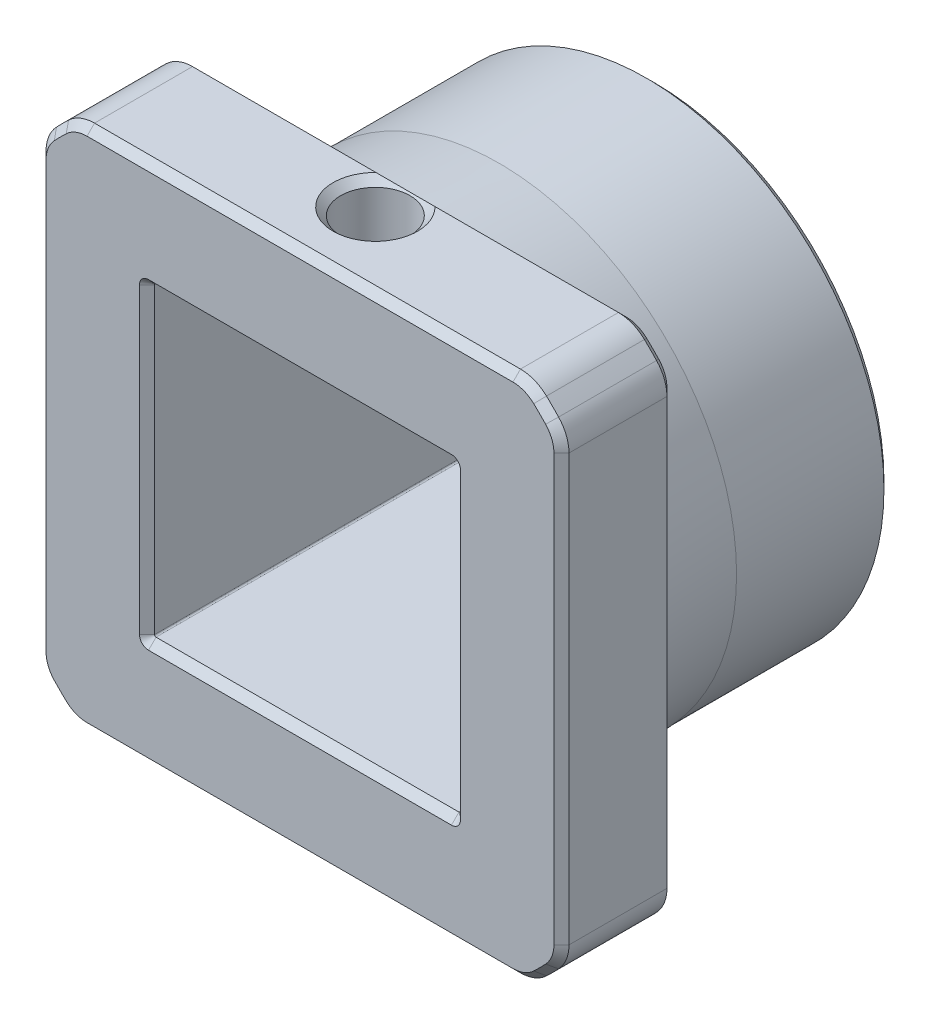
from build123d import *

# Parameters (mm, degrees)
SKIZZE1_R                       = 15.75
SKIZZE1_W                       = 20.3
SKIZZE1_H                       = 20.3
AUFSATZ_LINEAR_AUSTRAGEN1_DEPTH = 16
SKIZZE2_W                       = 20.3
SKIZZE2_H                       = 20.3
AUFSATZ_LINEAR_AUSTRAGEN2_DEPTH = 7.5
SCHNITT_LINEAR_AUSTRAGEN1_REACH = 47.358
SKIZZE3_R                       = 2.3
CHAMFER1_SIZE                   = 0.4
CHAMFER1_SIZE2                  = 5.720266503
VERRUNDUNG1_R                   = 0.1
VERRUNDUNG2_R                   = 2.5
FASE1_SIZE                      = 0.5
FASE4_SIZE                      = 0.5


with BuildPart() as part:
    # Skizze1 → Aufsatz-Linear austragen1 (new body)
    with BuildSketch(Plane.XY):
        Circle(SKIZZE1_R)
        Rectangle(SKIZZE1_W, SKIZZE1_H, mode=Mode.SUBTRACT)
    extrude(amount=AUFSATZ_LINEAR_AUSTRAGEN1_DEPTH)

    # Skizze2 → Aufsatz-Linear austragen2 (add)
    with BuildSketch(Plane.XY.offset(16)):
        with BuildLine():
            Line((-15.098923803, 17.35), (15.098923803, 17.35))
            ThreePointArc((15.098923803, 17.35), (16.263455967, 16.263455967), (17.35, 15.098923803))
            Line((17.35, 15.098923803), (17.35, -15.098923803))
            ThreePointArc((17.35, -15.098923803), (16.263455967, -16.263455967), (15.098923803, -17.35))
            Line((15.098923803, -17.35), (-15.098923803, -17.35))
            ThreePointArc((-15.098923803, -17.35), (-16.263455967, -16.263455967), (-17.35, -15.098923803))
            Line((-17.35, -15.098923803), (-17.35, 15.098923803))
            ThreePointArc((-17.35, 15.098923803), (-16.263455967, 16.263455967), (-15.098923803, 17.35))
        make_face()
        Rectangle(SKIZZE2_W, SKIZZE2_H, mode=Mode.SUBTRACT)
    extrude(amount=AUFSATZ_LINEAR_AUSTRAGEN2_DEPTH)

    # Skizze3 → Schnitt-Linear austragen1 (cut, up to next)
    with BuildSketch(Plane(origin=(0, 17.35, 0), x_dir=(1, 0, 0), z_dir=(0, 1, 0)), mode=Mode.PRIVATE) as schnitt_linear_austragen1_sk1:
        with Locations(Location((0, -18.5, 0), (0, 0, 270))):
            Circle(SKIZZE3_R)
    schnitt_linear_austragen1_tool1 = extrude(schnitt_linear_austragen1_sk1.sketch, amount=-SCHNITT_LINEAR_AUSTRAGEN1_REACH, mode=Mode.PRIVATE) & part.part
    add(schnitt_linear_austragen1_tool1.solids().sort_by_distance((0, 17.35, 18.5))[0], mode=Mode.SUBTRACT)

    # Chamfer1
    chamfer1_edges = [part.edges().sort_by_distance(p)[0] for p in [
        (-15.75, 0, 16),
    ]]
    chamfer1_side = [part.faces().sort_by_distance(p)[0] for p in [
        (-15.916455967, 15.916455967, 16),
    ]]
    chamfer(chamfer1_edges, length=CHAMFER1_SIZE, length2=CHAMFER1_SIZE2, reference=chamfer1_side[0])

    # Verrundung1
    verrundung1_edges = [part.edges().sort_by_distance(p)[0] for p in [
        (10.15, -10.15, 11.75),
        (10.15, 10.15, 11.75),
        (-10.15, 10.15, 11.75),
        (-10.15, -10.15, 11.75),
    ]]
    fillet(verrundung1_edges, radius=VERRUNDUNG1_R)

    # Verrundung2
    verrundung2_edges = [part.edges().sort_by_distance(p)[0] for p in [
        (-15.098923803, 17.35, 19.75),
        (-17.35, 15.098923803, 19.75),
        (-17.35, -15.098923803, 19.75),
        (-15.098923803, -17.35, 19.75),
        (15.098923803, -17.35, 19.75),
        (17.35, -15.098923803, 19.75),
        (17.35, 15.098923803, 19.75),
        (15.098923803, 17.35, 19.75),
    ]]
    fillet(verrundung2_edges, radius=VERRUNDUNG2_R)

    # Fase1
    # the kernel refuses this chamfer: 0.5 mm, written as the material it takes off along each edge
    with BuildSketch(Plane(origin=(-17.35, -14.13249801, 23.5), x_dir=(0.9996219169112968, 0, 0.027495876610589005), z_dir=(0, 1, 0)), Plane(origin=(14.13249801, -17.35, 23.5), x_dir=(0, 0.9996219169112968, 0.027495876610589005), z_dir=(-1, 0, 0)), Plane(origin=(17.35, 14.13249801, 23.5), x_dir=(-0.9996219169112968, 0, 0.027495876610589005), z_dir=(0, -1, 0)), Plane(origin=(-14.13249801, 17.35, 23.5), x_dir=(0, -0.9996219169112968, 0.027495876610589005), z_dir=(1, 0, 0))) as fase1_piece_1:
        Polygon((FASE1_SIZE * 0.999621916911, FASE1_SIZE * 0.0274958766106), (-FASE1_SIZE * 0.0274958766106, FASE1_SIZE * 0.999621916911), (0, 0), align=None)
    extrude(amount=28.26499602, mode=Mode.SUBTRACT)
    with BuildSketch(Plane(origin=(0, 0, 23.5), x_dir=(-0.7243902439024396, 0.6893901468246876, 0), z_dir=(-0.6893901468246876, -0.7243902439024396, 0))) as fase1_piece_2:
        Polygon((23 - FASE1_SIZE, 0), (23, FASE1_SIZE), (23, 0), align=None)
    revolve(axis=Axis((0, 0, 23.5), (0, 0, -1)), revolution_arc=2.836293852, mode=Mode.SUBTRACT)
    with BuildSketch(Plane(origin=(0, 0, 23.5), x_dir=(0.7243902439024391, -0.6893901468246878, 0), z_dir=(0.6893901468246878, 0.7243902439024391, 0))) as fase1_piece_3:
        Polygon((23 - FASE1_SIZE, 0), (23, FASE1_SIZE), (23, 0), align=None)
    revolve(axis=Axis((0, 0, 23.5), (0, 0, -1)), revolution_arc=2.836293852, mode=Mode.SUBTRACT)
    with BuildSketch(Plane(origin=(0, 0, 23.5), x_dir=(0.689390146824687, 0.7243902439024399, 0), z_dir=(-0.7243902439024399, 0.689390146824687, 0))) as fase1_piece_4:
        Polygon((23 - FASE1_SIZE, 0), (23, FASE1_SIZE), (23, 0), align=None)
    revolve(axis=Axis((0, 0, 23.5), (0, 0, -1)), revolution_arc=2.836293852, mode=Mode.SUBTRACT)
    with BuildSketch(Plane(origin=(-14.13249801, 14.85, 23.5), x_dir=(-0.689390146824687, 0.72439024390244, 0), z_dir=(-0.72439024390244, -0.689390146824687, 0))) as fase1_piece_5:
        Polygon((2.5 - FASE1_SIZE, 0), (2.5, FASE1_SIZE), (2.5, 0), align=None)
    revolve(axis=Axis((-14.13249801, 14.85, 23.5), (0, 0, -1)), revolution_arc=43.581853074, mode=Mode.SUBTRACT)
    with BuildSketch(Plane(origin=(-14.85, 14.13249801, 23.5), x_dir=(-0.7243902439024396, 0.6893901468246874, 0), z_dir=(0.6893901468246874, 0.7243902439024396, 0))) as fase1_piece_6:
        Polygon((2.5 - FASE1_SIZE, 0), (2.5, -FASE1_SIZE), (2.5, 0), align=None)
    revolve(axis=Axis((-14.85, 14.13249801, 23.5), (0, 0, 1)), revolution_arc=43.581853074, mode=Mode.SUBTRACT)
    with BuildSketch(Plane(origin=(14.13249801, 14.85, 23.5), x_dir=(0, 1, 0), z_dir=(-1, 0, 0))) as fase1_piece_7:
        Polygon((2.5 - FASE1_SIZE, 0), (2.5, FASE1_SIZE), (2.5, 0), align=None)
    revolve(axis=Axis((14.13249801, 14.85, 23.5), (0, 0, -1)), revolution_arc=43.581853074, mode=Mode.SUBTRACT)
    with BuildSketch(Plane(origin=(14.85, 14.13249801, 23.5), x_dir=(0.72439024390244, 0.689390146824687, 0), z_dir=(-0.689390146824687, 0.72439024390244, 0))) as fase1_piece_8:
        Polygon((2.5 - FASE1_SIZE, 0), (2.5, FASE1_SIZE), (2.5, 0), align=None)
    revolve(axis=Axis((14.85, 14.13249801, 23.5), (0, 0, -1)), revolution_arc=43.581853074, mode=Mode.SUBTRACT)
    with BuildSketch(Plane(origin=(14.85, -14.13249801, 23.5), x_dir=(1, 0, 0), z_dir=(0, 1, 0))) as fase1_piece_9:
        Polygon((2.5 - FASE1_SIZE, 0), (2.5, FASE1_SIZE), (2.5, 0), align=None)
    revolve(axis=Axis((14.85, -14.13249801, 23.5), (0, 0, -1)), revolution_arc=43.581853074, mode=Mode.SUBTRACT)
    with BuildSketch(Plane(origin=(14.13249801, -14.85, 23.5), x_dir=(0.6893901468246885, -0.7243902439024386, 0), z_dir=(0.7243902439024386, 0.6893901468246885, 0))) as fase1_piece_10:
        Polygon((2.5 - FASE1_SIZE, 0), (2.5, FASE1_SIZE), (2.5, 0), align=None)
    revolve(axis=Axis((14.13249801, -14.85, 23.5), (0, 0, -1)), revolution_arc=43.581853074, mode=Mode.SUBTRACT)
    with BuildSketch(Plane(origin=(-14.13249801, -14.85, 23.5), x_dir=(0, -1, 0), z_dir=(1, 0, 0))) as fase1_piece_11:
        Polygon((2.5 - FASE1_SIZE, 0), (2.5, FASE1_SIZE), (2.5, 0), align=None)
    revolve(axis=Axis((-14.13249801, -14.85, 23.5), (0, 0, -1)), revolution_arc=43.581853074, mode=Mode.SUBTRACT)
    with BuildSketch(Plane(origin=(-14.85, -14.13249801, 23.5), x_dir=(-0.7243902439024386, -0.6893901468246885, 0), z_dir=(0.6893901468246885, -0.7243902439024386, 0))) as fase1_piece_12:
        Polygon((2.5 - FASE1_SIZE, 0), (2.5, FASE1_SIZE), (2.5, 0), align=None)
    revolve(axis=Axis((-14.85, -14.13249801, 23.5), (0, 0, -1)), revolution_arc=43.581853074, mode=Mode.SUBTRACT)
    with BuildSketch(Plane(origin=(0, 0, 0), x_dir=(1, 0, 0), z_dir=(0, -1, 0))) as fase1_piece_13:
        Polygon((15.75 - FASE1_SIZE, 0), (15.75, FASE1_SIZE), (15.75, 0), align=None)
    revolve(axis=Axis((0, 0, 0), (0, 0, 1)), mode=Mode.SUBTRACT)
    with BuildSketch(Plane(origin=(0, 10.15, 18.5), x_dir=(0, 0, 1), z_dir=(-1, 0, 0))) as fase1_piece_14:
        Polygon((2.3 + FASE1_SIZE, 0), (2.3, FASE1_SIZE), (2.3, 0), align=None)
    revolve(axis=Axis((0, 10.15, 18.5), (0, 1, 0)), mode=Mode.SUBTRACT)
    with BuildSketch(Plane(origin=(0, 17.35, 18.5), x_dir=(0, 0, 1), z_dir=(-1, 0, 0))) as fase1_piece_15:
        Polygon((2.3 + FASE1_SIZE, 0), (2.3, -FASE1_SIZE), (2.3, 0), align=None)
    revolve(axis=Axis((0, 17.35, 18.5), (0, 1, 0)), mode=Mode.SUBTRACT)
    with BuildSketch(Plane(origin=(-10.05, -10.15, 0), x_dir=(0, 0.02749587661058563, 0.9996219169112968), z_dir=(1, 0, 0)), Plane(origin=(-10.05, -10.15, 23.5), x_dir=(0, -0.9996219169112968, 0.0274958766105891), z_dir=(1, 0, 0)), Plane(origin=(10.15, -10.05, 0), x_dir=(-0.02749587661058563, 0, 0.9996219169112968), z_dir=(0, 1, 0)), Plane(origin=(10.15, -10.05, 23.5), x_dir=(0.9996219169112968, 0, 0.0274958766105891), z_dir=(0, 1, 0)), Plane(origin=(-10.15, 10.05, 0), x_dir=(0.02749587661058563, 0, 0.9996219169112968), z_dir=(0, -1, 0)), Plane(origin=(-10.15, 10.05, 23.5), x_dir=(-0.9996219169112968, 0, 0.0274958766105891), z_dir=(0, -1, 0)), Plane(origin=(10.05, 10.15, 0), x_dir=(0, -0.02749587661058563, 0.9996219169112968), z_dir=(-1, 0, 0)), Plane(origin=(10.05, 10.15, 23.5), x_dir=(0, 0.9996219169112968, 0.0274958766105891), z_dir=(-1, 0, 0))) as fase1_piece_16:
        Polygon((FASE1_SIZE * 0.999621916911, FASE1_SIZE * 0.0274958766106), (-FASE1_SIZE * 0.0274958766106, FASE1_SIZE * 0.999621916911), (0, 0), align=None)
    extrude(amount=20.1, mode=Mode.SUBTRACT)
    with BuildSketch(Plane(origin=(10.05, -10.05, 0), x_dir=(1, 0, 0), z_dir=(0, 1, 0))) as fase1_piece_17:
        Polygon((0.1, -FASE1_SIZE), (0.1 + FASE1_SIZE, 0), (0.1, 0), align=None)
    revolve(axis=Axis((10.05, -10.05, 0), (0, 0, -1)), revolution_arc=90, mode=Mode.SUBTRACT)
    with BuildSketch(Plane(origin=(10.05, -10.05, 23.5), x_dir=(1, 0, 0), z_dir=(0, 1, 0))) as fase1_piece_18:
        Polygon((0.1 + FASE1_SIZE, 0), (0.1, FASE1_SIZE), (0.1, 0), align=None)
    revolve(axis=Axis((10.05, -10.05, 23.5), (0, 0, -1)), revolution_arc=90, mode=Mode.SUBTRACT)
    with BuildSketch(Plane(origin=(-10.05, -10.05, 0), x_dir=(-1, 0, 0), z_dir=(0, 1, 0))) as fase1_piece_19:
        Polygon((0.1, FASE1_SIZE), (0.1 + FASE1_SIZE, 0), (0.1, 0), align=None)
    revolve(axis=Axis((-10.05, -10.05, 0), (0, 0, 1)), revolution_arc=90, mode=Mode.SUBTRACT)
    with BuildSketch(Plane(origin=(-10.05, -10.05, 23.5), x_dir=(-1, 0, 0), z_dir=(0, 1, 0))) as fase1_piece_20:
        Polygon((0.1 + FASE1_SIZE, 0), (0.1, -FASE1_SIZE), (0.1, 0), align=None)
    revolve(axis=Axis((-10.05, -10.05, 23.5), (0, 0, 1)), revolution_arc=90, mode=Mode.SUBTRACT)
    with BuildSketch(Plane(origin=(-10.05, 10.05, 0), x_dir=(-1, 0, 0), z_dir=(0, -1, 0))) as fase1_piece_21:
        Polygon((0.1, -FASE1_SIZE), (0.1 + FASE1_SIZE, 0), (0.1, 0), align=None)
    revolve(axis=Axis((-10.05, 10.05, 0), (0, 0, -1)), revolution_arc=90, mode=Mode.SUBTRACT)
    with BuildSketch(Plane(origin=(-10.05, 10.05, 23.5), x_dir=(-1, 0, 0), z_dir=(0, -1, 0))) as fase1_piece_22:
        Polygon((0.1 + FASE1_SIZE, 0), (0.1, FASE1_SIZE), (0.1, 0), align=None)
    revolve(axis=Axis((-10.05, 10.05, 23.5), (0, 0, -1)), revolution_arc=90, mode=Mode.SUBTRACT)
    with BuildSketch(Plane(origin=(10.05, 10.05, 0), x_dir=(0, 1, 0), z_dir=(-1, 0, 0))) as fase1_piece_23:
        Polygon((0.1, -FASE1_SIZE), (0.1 + FASE1_SIZE, 0), (0.1, 0), align=None)
    revolve(axis=Axis((10.05, 10.05, 0), (0, 0, -1)), revolution_arc=90, mode=Mode.SUBTRACT)
    with BuildSketch(Plane(origin=(10.05, 10.05, 23.5), x_dir=(0, 1, 0), z_dir=(-1, 0, 0))) as fase1_piece_24:
        Polygon((0.1 + FASE1_SIZE, 0), (0.1, FASE1_SIZE), (0.1, 0), align=None)
    revolve(axis=Axis((10.05, 10.05, 23.5), (0, 0, -1)), revolution_arc=90, mode=Mode.SUBTRACT)
    with BuildSketch(Plane(origin=(0, 0, 23.5), x_dir=(-0.6893901468246829, -0.7243902439024439, 0), z_dir=(0.7243902439024439, -0.6893901468246829, 0))) as fase1_piece_25:
        Polygon((23 - FASE1_SIZE, 0), (23, FASE1_SIZE), (23, 0), align=None)
    revolve(axis=Axis((0, 0, 23.5), (0, 0, -1)), revolution_arc=2.836293852, mode=Mode.SUBTRACT)

    # Fase4
    # the kernel refuses this chamfer: 0.5 mm, written as the material it takes off along each edge
    with BuildSketch(Plane(origin=(14.13249801, -17.35, 16), x_dir=(0, -0.027495876610589005, 0.9996219169112968), z_dir=(-1, 0, 0)), Plane(origin=(17.35, 14.13249801, 16), x_dir=(0.027495876610589005, 0, 0.9996219169112968), z_dir=(0, -1, 0)), Plane(origin=(-17.35, -14.13249801, 16), x_dir=(-0.027495876610589005, 0, 0.9996219169112968), z_dir=(0, 1, 0))) as fase4_piece_1:
        Polygon((FASE4_SIZE * 0.999621916911, FASE4_SIZE * 0.0274958766106), (-FASE4_SIZE * 0.0274958766106, FASE4_SIZE * 0.999621916911), (0, 0), align=None)
    extrude(amount=28.26499602, mode=Mode.SUBTRACT)
    with BuildSketch(Plane(origin=(14.13249801, -14.85, 16), x_dir=(0.6893901468246885, -0.7243902439024386, 0), z_dir=(0.7243902439024386, 0.6893901468246885, 0))) as fase4_piece_2:
        Polygon((2.5, -FASE4_SIZE), (2.5 - FASE4_SIZE, 0), (2.5, 0), align=None)
    revolve(axis=Axis((14.13249801, -14.85, 16), (0, 0, -1)), revolution_arc=43.581853074, mode=Mode.SUBTRACT)
    with BuildSketch(Plane(origin=(-14.13249801, -14.85, 16), x_dir=(0, -1, 0), z_dir=(1, 0, 0))) as fase4_piece_3:
        Polygon((2.5, -FASE4_SIZE), (2.5 - FASE4_SIZE, 0), (2.5, 0), align=None)
    revolve(axis=Axis((-14.13249801, -14.85, 16), (0, 0, -1)), revolution_arc=43.581853074, mode=Mode.SUBTRACT)
    with BuildSketch(Plane(origin=(0, 0, 16), x_dir=(0.7243902439024391, -0.6893901468246878, 0), z_dir=(0.6893901468246878, 0.7243902439024391, 0))) as fase4_piece_4:
        Polygon((23, -FASE4_SIZE), (23 - FASE4_SIZE, 0), (23, 0), align=None)
    revolve(axis=Axis((0, 0, 16), (0, 0, -1)), revolution_arc=2.836293852, mode=Mode.SUBTRACT)
    with BuildSketch(Plane(origin=(0, 0, 16), x_dir=(-0.6893901468246829, -0.7243902439024439, 0), z_dir=(0.7243902439024439, -0.6893901468246829, 0))) as fase4_piece_5:
        Polygon((23, -FASE4_SIZE), (23 - FASE4_SIZE, 0), (23, 0), align=None)
    revolve(axis=Axis((0, 0, 16), (0, 0, -1)), revolution_arc=2.836293852, mode=Mode.SUBTRACT)
    with BuildSketch(Plane(origin=(14.85, -14.13249801, 16), x_dir=(1, 0, 0), z_dir=(0, 1, 0))) as fase4_piece_6:
        Polygon((2.5, -FASE4_SIZE), (2.5 - FASE4_SIZE, 0), (2.5, 0), align=None)
    revolve(axis=Axis((14.85, -14.13249801, 16), (0, 0, -1)), revolution_arc=43.581853074, mode=Mode.SUBTRACT)
    with BuildSketch(Plane(origin=(-14.85, -14.13249801, 16), x_dir=(-0.7243902439024386, -0.6893901468246885, 0), z_dir=(0.6893901468246885, -0.7243902439024386, 0))) as fase4_piece_7:
        Polygon((2.5, -FASE4_SIZE), (2.5 - FASE4_SIZE, 0), (2.5, 0), align=None)
    revolve(axis=Axis((-14.85, -14.13249801, 16), (0, 0, -1)), revolution_arc=43.581853074, mode=Mode.SUBTRACT)
    with BuildSketch(Plane(origin=(14.85, 14.13249801, 16), x_dir=(0.72439024390244, 0.689390146824687, 0), z_dir=(-0.689390146824687, 0.72439024390244, 0))) as fase4_piece_8:
        Polygon((2.5, -FASE4_SIZE), (2.5 - FASE4_SIZE, 0), (2.5, 0), align=None)
    revolve(axis=Axis((14.85, 14.13249801, 16), (0, 0, -1)), revolution_arc=43.581853074, mode=Mode.SUBTRACT)
    with BuildSketch(Plane(origin=(-14.85, 14.13249801, 16), x_dir=(-0.7243902439024396, 0.6893901468246874, 0), z_dir=(0.6893901468246874, 0.7243902439024396, 0))) as fase4_piece_9:
        Polygon((2.5, FASE4_SIZE), (2.5 - FASE4_SIZE, 0), (2.5, 0), align=None)
    revolve(axis=Axis((-14.85, 14.13249801, 16), (0, 0, 1)), revolution_arc=43.581853074, mode=Mode.SUBTRACT)
    with BuildSketch(Plane(origin=(0, 0, 16), x_dir=(0.689390146824687, 0.7243902439024399, 0), z_dir=(-0.7243902439024399, 0.689390146824687, 0))) as fase4_piece_10:
        Polygon((23, -FASE4_SIZE), (23 - FASE4_SIZE, 0), (23, 0), align=None)
    revolve(axis=Axis((0, 0, 16), (0, 0, -1)), revolution_arc=2.836293852, mode=Mode.SUBTRACT)
    with BuildSketch(Plane(origin=(0, 0, 16), x_dir=(-0.7243902439024396, 0.6893901468246876, 0), z_dir=(-0.6893901468246876, -0.7243902439024396, 0))) as fase4_piece_11:
        Polygon((23, -FASE4_SIZE), (23 - FASE4_SIZE, 0), (23, 0), align=None)
    revolve(axis=Axis((0, 0, 16), (0, 0, -1)), revolution_arc=2.836293852, mode=Mode.SUBTRACT)
    with BuildSketch(Plane(origin=(14.13249801, 14.85, 16), x_dir=(0, 1, 0), z_dir=(-1, 0, 0))) as fase4_piece_12:
        Polygon((2.5, -FASE4_SIZE), (2.5 - FASE4_SIZE, 0), (2.5, 0), align=None)
    revolve(axis=Axis((14.13249801, 14.85, 16), (0, 0, -1)), revolution_arc=43.581853074, mode=Mode.SUBTRACT)
    with BuildSketch(Plane(origin=(-14.13249801, 14.85, 16), x_dir=(-0.689390146824687, 0.72439024390244, 0), z_dir=(-0.72439024390244, -0.689390146824687, 0))) as fase4_piece_13:
        Polygon((2.5, -FASE4_SIZE), (2.5 - FASE4_SIZE, 0), (2.5, 0), align=None)
    revolve(axis=Axis((-14.13249801, 14.85, 16), (0, 0, -1)), revolution_arc=43.581853074, mode=Mode.SUBTRACT)
    with BuildSketch(Plane(origin=(-0.024889473, 17.35, 16), x_dir=(0, 0.027495876610589005, 0.9996219169112968), z_dir=(1, 0, 0)), Plane(origin=(-14.13249801, 17.35, 16), x_dir=(0, 0.027495876610589005, 0.9996219169112968), z_dir=(1, 0, 0))) as fase4_piece_14:
        Polygon((FASE4_SIZE * 0.999621916911, FASE4_SIZE * 0.0274958766106), (-FASE4_SIZE * 0.0274958766106, FASE4_SIZE * 0.999621916911), (0, 0), align=None)
    extrude(amount=14.157387483, mode=Mode.SUBTRACT)


solid = part.part
